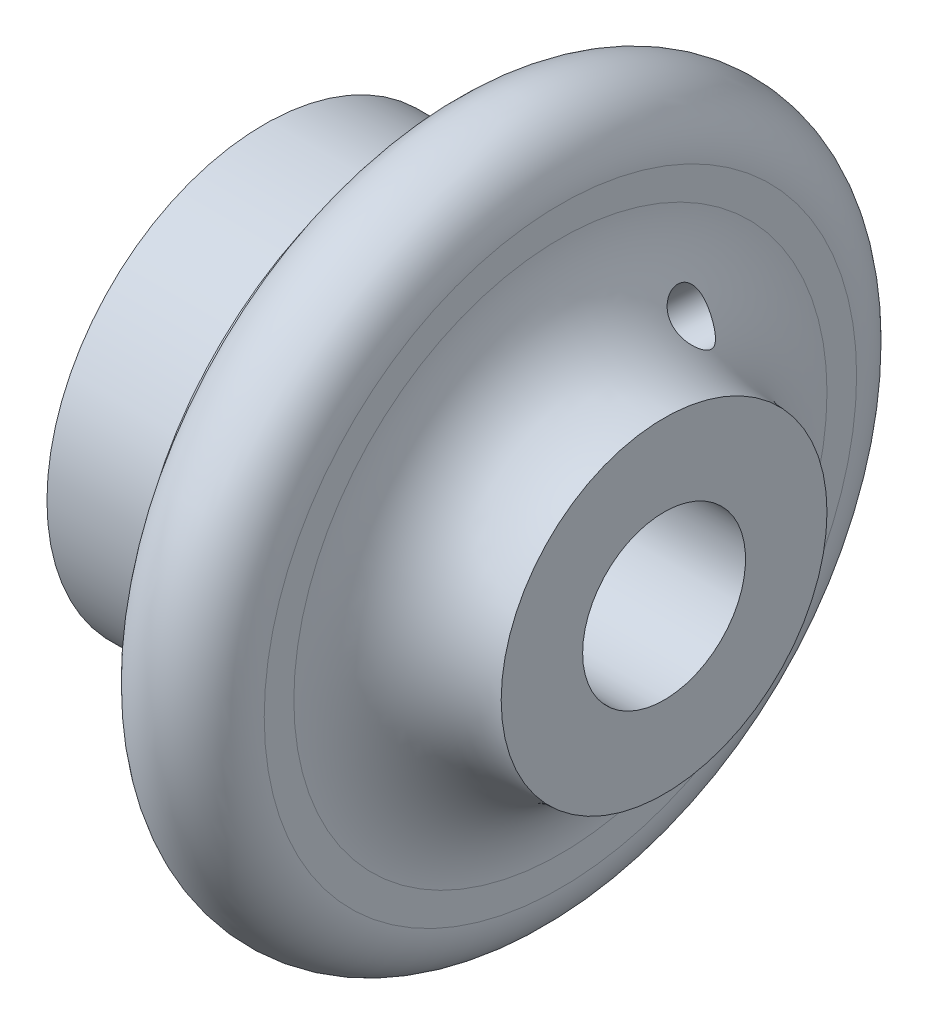
from build123d import *


with BuildPart() as part:
    # Sketch1 → Revolve1 (revolve)
    with BuildSketch(Plane.XY, mode=Mode.PRIVATE) as revolve1_sk:
        with BuildLine():
            Line((0, 5.5), (0, 14.67))
            Line((0, 14.67), (8, 14.67))
            Line((8, 14.67), (8, 13.17))
            Line((8, 13.17), (11, 13.17))
            Line((11, 13.17), (11, 20))
            Line((11, 20), (12, 20))
            ThreePointArc((12, 20), (16, 24), (20, 20))
            Line((20, 20), (20, 18))
            ThreePointArc((20, 18), (22.050252532, 13.050252532), (27, 11))
            Line((27, 11), (27, 5.5))
            Line((27, 5.5), (0, 5.5))
        make_face()
    revolve(revolve1_sk.sketch.rotate(Axis((0, 0, 0), (1, 0, 0)), 90), axis=Axis((0, 0, 0), (1, 0, 0)))

    # Ø3.5 (3.5) Diameter Hole2: read off the stored shape, not the designer's step
    # Ø3.5 (3.5) Diameter Hole2: loft between two sections, ruled curve by curve
    f_3_5_3_5_diameter_hole2_from = [
        Edge.make_three_point_arc((12.584394195, 4.719603739, -2.823958877), (13.87319466, 4.552306942, -0.717776277), (15.109619522, 2.611483824, -1.628522776)),
        Edge.make_three_point_arc((15.109619522, 2.611483824, -1.628522776), (13.820819057, 2.778780621, -3.734705376), (12.584394195, 4.719603739, -2.823958877)),
    ]
    f_3_5_3_5_diameter_hole2_to = [
        Edge.make_three_point_arc((21.045529414, 12.258443907, -7.402617534), (22.334329879, 12.09114711, -5.296434934), (23.570754741, 10.150323992, -6.207181432)),
        Edge.make_three_point_arc((23.570754741, 10.150323992, -6.207181432), (22.281954276, 10.317620789, -8.313364032), (21.045529414, 12.258443907, -7.402617534)),
    ]
    f_3_5_3_5_diameter_hole2 = Solid(Shell([*[Face.make_surface_from_curves(f_3_5_3_5_diameter_hole2_from[k], f_3_5_3_5_diameter_hole2_to[k]) for k in range(2)], Face(Wire(f_3_5_3_5_diameter_hole2_from)), Face(Wire(f_3_5_3_5_diameter_hole2_to))]))
    add(f_3_5_3_5_diameter_hole2, mode=Mode.SUBTRACT)


solid = part.part
